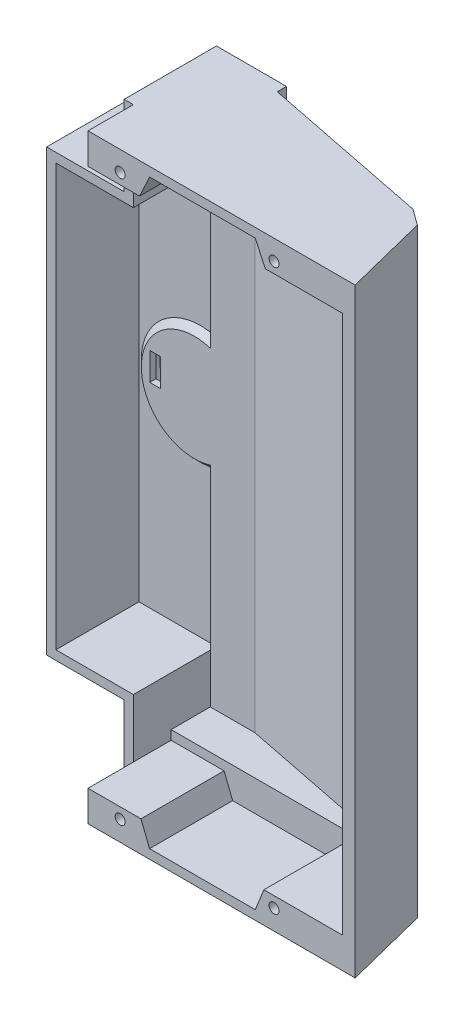
from build123d import *

# Parameters (mm, degrees)
CROQUIS1_W                 = 78.58
CROQUIS1_H                 = 17.74
SALIENTE_EXTRUIR1_DEPTH    = 195
CORTAR_EXTRUIR1_DEPTH      = 200.116501074
CORTAR_EXTRUIR1_DEPTH_BACK = 200.116501074
CHAFL_N1_SIZE2             = 3.821967962
CHAFL_N1_SIZE              = 3
CROQUIS4_W                 = 3
CROQUIS4_H                 = 195
SALIENTE_EXTRUIR2_DEPTH    = 3
CROQUIS5_W                 = 25.18
CROQUIS5_H                 = 143
SALIENTE_EXTRUIR3_DEPTH    = 3
REDONDEO1_R                = 2
CORTAR_EXTRUIR2_DEPTH      = 208.103617786
CORTAR_EXTRUIR2_DEPTH_BACK = 208.103617786
CROQUIS6_R                 = 1.625
CORTAR_EXTRUIR3_START      = -3
CROQUIS7_R                 = 3.5
CORTAR_EXTRUIR3_DEPTH      = 205.103617786
CROQUIS8_R                 = 16.25
CROQUIS8_R_2               = 8.75
CORTAR_EXTRUIR4_DEPTH      = 3
CROQUIS9_R                 = 17.25
SALIENTE_EXTRUIR4_DEPTH    = 2
CHAFL_N2_SIZE              = 2
CORTAR_EXTRUIR6_DEPTH      = 208.103617786
CORTAR_EXTRUIR6_DEPTH_BACK = 208.103617786
CROQUIS10_W                = 3.5
CROQUIS10_H                = 9
CORTAR_EXTRUIR7_DEPTH      = 1
CORTAR_EXTRUIR8_START      = -13
CORTAR_EXTRUIR8_DEPTH      = 169
SALIENTE_EXTRUIR6_START    = 27
CROQUIS16_R                = 1.625
SALIENTE_EXTRUIR6_DEPTH    = 27
SALIENTE_EXTRUIR9_DEPTH    = 27
SALIENTE_EXTRUIR10_DEPTH   = 195
SALIENTE_EXTRUIR11_START   = -10
SALIENTE_EXTRUIR11_DEPTH   = 10
SALIENTE_EXTRUIR12_START   = -10
SALIENTE_EXTRUIR12_DEPTH   = 10


# Read off the part's stored shape, not the designer's step: Saliente-Extruir11, Saliente-Extruir12
with BuildPart() as part:
    # Croquis1 → Saliente-Extruir1 (new body)
    with BuildSketch(Plane(origin=(0, 0, 0), x_dir=(1, 0, 0), z_dir=(0, 1, 0))):
        Rectangle(CROQUIS1_W, CROQUIS1_H)
    extrude(amount=SALIENTE_EXTRUIR1_DEPTH)

    # Croquis2 → Cortar-Extruir1 (cut, two sides: drawn at the far end of the back side and taken through both)
    with BuildSketch(Plane.XZ.offset(-CORTAR_EXTRUIR1_DEPTH_BACK)):
        Polygon((39.29, 5.87), (-19.532543769, -5.87), (-19.532543769, -8.87), (39.29, -8.87), align=None)
    extrude(amount=CORTAR_EXTRUIR1_DEPTH + CORTAR_EXTRUIR1_DEPTH_BACK, mode=Mode.SUBTRACT)

    # Chaflán1
    chafl_n1_edges = [part.edges().sort_by_distance(p)[0] for p in [
        (39.29, 97.5, 5.87),
    ]]
    chafl_n1_side = [part.faces().sort_by_distance(p)[0] for p in [
        (39.29, 97.5, 5.93),
    ]]
    chamfer(chafl_n1_edges, length=CHAFL_N1_SIZE - 0.0001, length2=CHAFL_N1_SIZE2 - 0.0001, reference=chafl_n1_side[0])  # a hair under: the kernel refuses the full size

    # Croquis4 → Saliente-Extruir2 (add)
    with BuildSketch(Plane(origin=(0, 0, -8.87), x_dir=(-1, 0, 0), z_dir=(0, 0, -1))):
        with Locations((40.79, 97.5)):
            Rectangle(CROQUIS4_W, CROQUIS4_H)
    extrude(amount=-SALIENTE_EXTRUIR2_DEPTH)

    # Croquis5 → Saliente-Extruir3 (add)
    with BuildSketch(Plane(origin=(0, 0, -8.87), x_dir=(-1, 0, 0), z_dir=(0, 0, -1))):
        with Locations((54.88, 97.5)):
            Rectangle(CROQUIS5_W, CROQUIS5_H)
    extrude(amount=-SALIENTE_EXTRUIR3_DEPTH)

    # Redondeo1
    redondeo1_edges = [part.edges().sort_by_distance(p)[0] for p in [
        (-67.47, 97.5, -8.87),
    ]]
    fillet(redondeo1_edges, radius=REDONDEO1_R)

    # Croquis6 → Cortar-Extruir2 (cut, two sides: drawn at the far end of the back side and taken through both)
    with BuildSketch(Plane.XY.offset(8.87).offset(-CORTAR_EXTRUIR2_DEPTH_BACK)):
        with Locations((-28.84, 188.5)):
            Circle(CROQUIS6_R)
        with Locations((21.16, 188.5)):
            Circle(CROQUIS6_R)
        with Locations((21.16, 6.5)):
            Circle(CROQUIS6_R)
        with Locations(Location((-28.84, 6.5, 0), (0, 0, 180))):
            Circle(CROQUIS6_R)
    extrude(amount=CORTAR_EXTRUIR2_DEPTH + CORTAR_EXTRUIR2_DEPTH_BACK, mode=Mode.SUBTRACT)

    # Croquis7 → Cortar-Extruir3 (cut, through all)
    with BuildSketch(Plane.XY.offset(8.87).offset(CORTAR_EXTRUIR3_START)):
        with Locations((-28.84, 188.5)):
            Circle(CROQUIS7_R)
        with Locations((21.16, 188.5)):
            Circle(CROQUIS7_R)
        with Locations((-28.84, 6.5)):
            Circle(CROQUIS7_R)
        with Locations((21.16, 6.5)):
            Circle(CROQUIS7_R)
    extrude(amount=-CORTAR_EXTRUIR3_DEPTH, mode=Mode.SUBTRACT)

    # Croquis8 → Cortar-Extruir4 (cut)
    with BuildSketch(Plane(origin=(0, 0, -8.87), x_dir=(-1, 0, 0), z_dir=(0, 0, -1))):
        with Locations((44.469949206, 97.5)):
            Circle(CROQUIS8_R)
        with Locations((44.469949206, 97.5)):
            Circle(CROQUIS8_R_2, mode=Mode.SUBTRACT)
    extrude(amount=-CORTAR_EXTRUIR4_DEPTH, mode=Mode.SUBTRACT)

    # Croquis9 → Saliente-Extruir4 (add)
    with BuildSketch(Plane.XY.offset(-5.87)):
        with Locations((-44.469949206, 97.5)):
            Circle(CROQUIS9_R)
    extrude(amount=SALIENTE_EXTRUIR4_DEPTH)

    # Chaflán2
    chafl_n2_edges = [part.edges().sort_by_distance(p)[0] for p in [
        (-61.719949206, 97.5, -5.87),
    ]]
    chamfer(chafl_n2_edges, length=CHAFL_N2_SIZE - 0.0001)  # a hair under: the kernel refuses the full size

    # Croquis10 → Cortar-Extruir6 (cut, two sides: drawn at the far end of the back side and taken through both)
    with BuildSketch(Plane(origin=(0, 0, -8.87), x_dir=(-1, 0, 0), z_dir=(0, 0, -1)).offset(-CORTAR_EXTRUIR6_DEPTH_BACK)):
        with Locations((57.22, 99)):
            Rectangle(CROQUIS10_W, CROQUIS10_H)
    extrude(amount=CORTAR_EXTRUIR6_DEPTH + CORTAR_EXTRUIR6_DEPTH_BACK, mode=Mode.SUBTRACT)

    # Croquis11 → Cortar-Extruir7 (cut)
    with BuildSketch(Plane(origin=(0.378430223, 0, -1.896101224), x_dir=(-0.9806591733939511, 0, -0.1957232373487947), z_dir=(0.19572323734879468, 0, -0.980659173393951))):
        Polygon((-28.864838216, 97.5), (-15.458781877, 92.947300595), (-7.58538371, 97.5), (-15.458781877, 102.052699405), align=None)
        Polygon((-10.689272405, 88.750905342), (-6.961025568, 83.426417054), (-14.813228871, 81.895762524), align=None)
        Polygon((-8.5598171, 92.683515176), (-1.676899864, 82.853690645), (9.381652734, 90.596972535), (4.548100867, 97.5), (9.381652734, 104.403027465), (-1.676899864, 112.146309355), (-8.5598171, 102.316484824), (-2.496901935, 106.616608043), (2.418010331, 103.175149425), (-1.555772077, 97.5), (2.418010331, 91.824850575), (-2.496901935, 88.383391957), align=None)
        Polygon((7.048100867, 97.5), (9.548100867, 95), (14.008259291, 97.5), (9.548100867, 100), align=None)
        Polygon((-14.813228871, 113.104237476), (-10.689272405, 106.249094658), (-6.961025568, 111.573582946), align=None)
    extrude(amount=-CORTAR_EXTRUIR7_DEPTH, mode=Mode.SUBTRACT)

    # Croquis12 → Cortar-Extruir8 (cut)
    with BuildSketch(Plane.XZ.offset(CORTAR_EXTRUIR8_START)):
        Polygon((-20.119713481, -2.92802248), (-24.839433576, -3.87), (-39.29, -3.87), (-39.29, 8.87), (35.047359313, 8.87), (34.063379787, 7.886020474), align=None)
    extrude(amount=-CORTAR_EXTRUIR8_DEPTH, mode=Mode.SUBTRACT)

    # Croquis16 → Saliente-Extruir6 (add)
    # profile 1 of 2: a face of its own
    with BuildSketch(Plane.XY.offset(8.87).offset(SALIENTE_EXTRUIR6_START)):
        Polygon((15.05, 3), (17.847845949, 10), (35.05, 10), (35.05, 0), (15.05, 0), (-19.29, 0), (-39.29, 0), (-39.29, 10), (-22.086, 10), (-19.29, 3), align=None)
        with Locations((-28.84, 6.5)):
            Circle(CROQUIS16_R, mode=Mode.SUBTRACT)
        with Locations((21.16, 6.5)):
            Circle(CROQUIS16_R, mode=Mode.SUBTRACT)
    # profile 2 of 2: a face of its own
    with BuildSketch(Plane.XY.offset(8.87).offset(SALIENTE_EXTRUIR6_START)):
        Polygon((-39.29, 195), (-19.29, 195), (15.05, 195), (35.05, 195), (35.05, 185), (18.314153607, 185), (15.05, 192), (-19.29, 192), (-22.552, 185), (-39.29, 185), align=None)
        with Locations((-28.84, 188.5)):
            Circle(CROQUIS16_R, mode=Mode.SUBTRACT)
        with Locations((21.16, 188.5)):
            Circle(CROQUIS16_R, mode=Mode.SUBTRACT)
    extrude(amount=-SALIENTE_EXTRUIR6_DEPTH)

    # Croquis19 → Saliente-Extruir9 (add)
    with BuildSketch(Plane.XY.offset(-5.87)):
        Polygon((-42.29, 26), (-42.29, 0), (-39.29, 0), (-39.29, 26), (-39.29, 29), (-64.47, 29), (-64.47, 166), (-39.29, 166), (-39.29, 195), (-42.29, 195), (-42.29, 169), (-67.47, 169), (-67.47, 26), align=None)
    extrude(amount=SALIENTE_EXTRUIR9_DEPTH)

    # Croquis20 → Saliente-Extruir10 (add)
    with BuildSketch(Plane.XZ):
        Polygon((47.510578309, 35.87), (43.385937322, 35.87), (36.593333228, 8.87), (35.541952057, 5.121952057), (40.717974215, 8.87), align=None)
    extrude(amount=-SALIENTE_EXTRUIR10_DEPTH)

    # Saliente-Extruir11 outline → Saliente-Extruir11 (add)
    with BuildSketch(Plane.XZ.offset(SALIENTE_EXTRUIR11_START)):
        Polygon((36.593333228, 8.87), (43.385937322, 35.87), (35.05, 35.87), (35.05, 8.87), align=None)
    extrude(amount=SALIENTE_EXTRUIR11_DEPTH)

    # Saliente-Extruir12 outline → Saliente-Extruir12 (add)
    with BuildSketch(Plane(origin=(0, 195, 0), x_dir=(1, 0, 0), z_dir=(0, 1, 0)).offset(SALIENTE_EXTRUIR12_START)):
        Polygon((35.05, -35.87), (43.385937322, -35.87), (36.593333228, -8.87), (35.05, -8.87), align=None)
    extrude(amount=SALIENTE_EXTRUIR12_DEPTH)


solid = part.part
